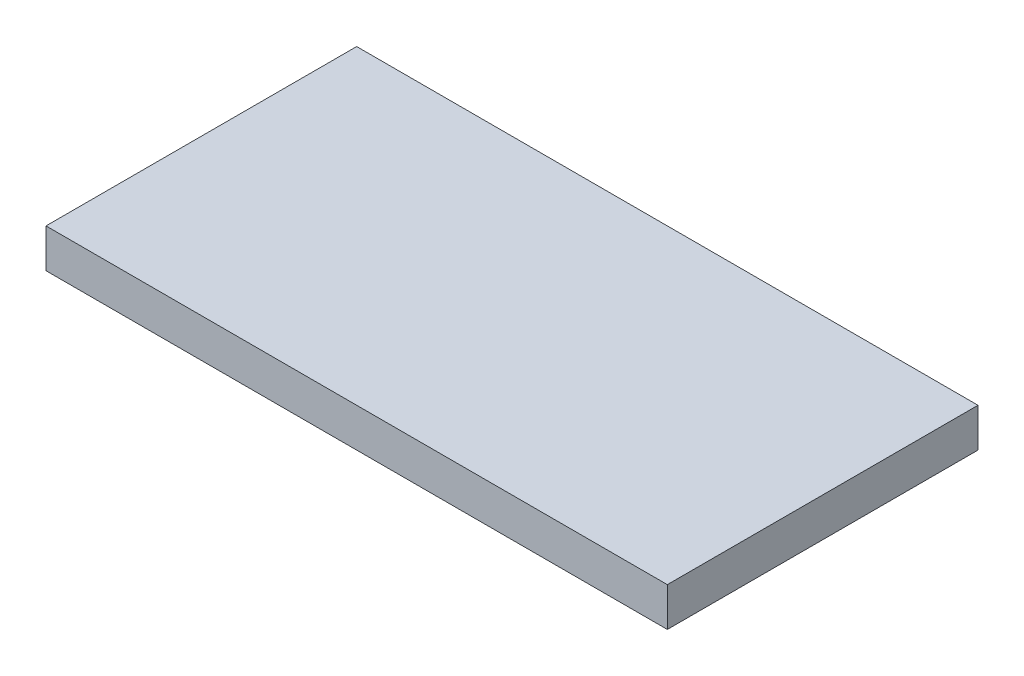
from build123d import *

# Parameters (mm, degrees)
SKETCH1_W           = 406.4
SKETCH1_H           = 203.2
BOSS_EXTRUDE1_DEPTH = 12.7


with BuildPart() as part:
    # Sketch1 → Boss-Extrude1 (new, symmetric)
    with BuildSketch(Plane(origin=(0, 0, 0), x_dir=(1, 0, 0), z_dir=(0, 1, 0))):
        Rectangle(SKETCH1_W, SKETCH1_H)
    extrude(amount=BOSS_EXTRUDE1_DEPTH, both=True)


solid = part.part
